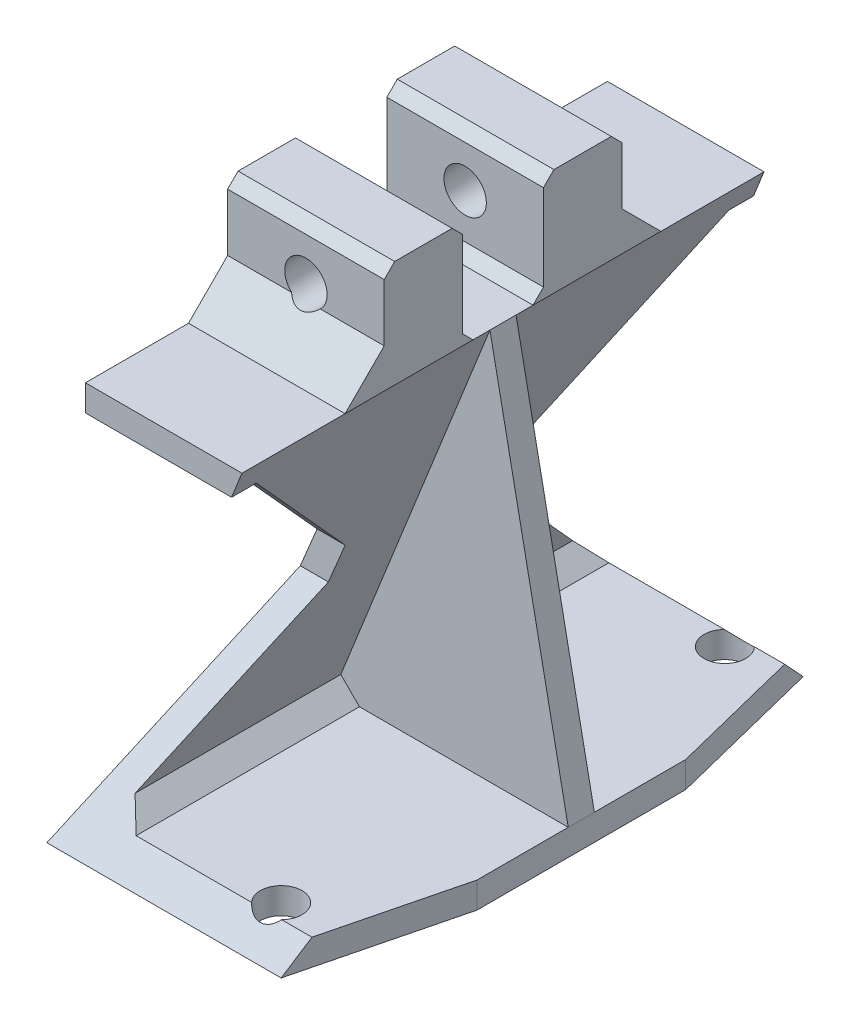
from build123d import *
from OCP.BRepFilletAPI import BRepFilletAPI_MakeChamfer

# Parameters (mm, degrees)
BOSS_EXTRUDE1_DEPTH     = 40
CUT_EXTRUDE1_DEPTH      = 30
CUT_EXTRUDE1_DEPTH_BACK = 30
CHAMFER1_SIZE           = 2
CHAMFER1_SIZE2          = 1.538618516
CHAMFER1_SIZE2_2        = 2.126587288
SKETCH3_R               = 1.6
CUT_EXTRUDE2_DEPTH      = 10
SKETCH4_W               = 6
SKETCH4_H               = 8.2
BOSS_EXTRUDE2_DEPTH     = 12
CHAMFER2_SIZE           = 3
CHAMFER3_SIZE           = 0.8
CUT_EXTRUDE3_DEPTH      = 47.848799344
CUT_EXTRUDE3_DEPTH_BACK = 47.848799344
SKETCH5_R               = 1.625
RIB1_REACH              = 43.809
SKETCH8_WALL_W          = 116.212296924
SKETCH8_WALL_H          = 2


with BuildPart() as part:
    # Sketch1 → Boss-Extrude1 (new body)
    with BuildSketch(Plane.XY):
        Polygon((0, 0), (12, 0), (0, -30), (18, -30), (18, -32), (-2.954065923, -32), (9.045934077, -2), (0, -2), align=None)
    extrude(amount=BOSS_EXTRUDE1_DEPTH)

    # Sketch2 → Cut-Extrude1 (cut, two sides: drawn at the far end of the back side and taken through both)
    with BuildSketch(Plane.ZY.offset(-CUT_EXTRUDE1_DEPTH_BACK)):
        Polygon((15.099668871, -16), (1.887458609, -2), (0, -2), (0, -32), align=None)
        Polygon((40, -2), (38.112541391, -2), (24.900331129, -16), (40, -32), align=None)
    extrude(amount=CUT_EXTRUDE1_DEPTH + CUT_EXTRUDE1_DEPTH_BACK, mode=Mode.SUBTRACT)

    # Chamfer1: one chamfer whose edges measure the first distance from different faces: ONE call of the kernel's chamfer builder (chamfer() names one face for all edges)
    chamfer1_edges_1 = [part.edges().sort_by_distance(p)[0] for p in [
        (0, -30, 20),
    ]]
    chamfer1_side_1 = [part.faces().sort_by_distance(p)[0] for p in [
        (9, -30, 20),
    ]]
    chamfer1_edges_2 = [part.edges().sort_by_distance(p)[0] for p in [
        (9.045934077, -2, 20),
    ]]
    chamfer1_side_2 = [part.faces().sort_by_distance(p)[0] for p in [
        (4.646047571, -2, 20),
    ]]
    chamfer1_edges_3 = [part.edges().sort_by_distance(p)[0] for p in [
        (4.522967039, -16, 24.900331129),
    ]]
    chamfer1_side_3 = [part.faces().sort_by_distance(p)[0] for p in [
        (7.322967039, -9, 31.50643626),
    ]]
    chamfer1_edges_4 = [part.edges().sort_by_distance(p)[0] for p in [
        (4.522967039, -16, 15.099668871),
    ]]
    chamfer1_side_4 = [part.faces().sort_by_distance(p)[0] for p in [
        (7.322967039, -9, 8.49356374),
    ]]
    chamfer1 = BRepFilletAPI_MakeChamfer(part.part.solid().wrapped)
    for e in chamfer1_edges_1:
        chamfer1.Add(CHAMFER1_SIZE, CHAMFER1_SIZE2, e.wrapped, chamfer1_side_1[0].wrapped)  # the first distance lies on this face
    for e in chamfer1_edges_2:
        chamfer1.Add(CHAMFER1_SIZE, CHAMFER1_SIZE2, e.wrapped, chamfer1_side_2[0].wrapped)  # the first distance lies on this face
    for e in chamfer1_edges_3:
        chamfer1.Add(CHAMFER1_SIZE, CHAMFER1_SIZE2_2, e.wrapped, chamfer1_side_3[0].wrapped)  # the first distance lies on this face
    for e in chamfer1_edges_4:
        chamfer1.Add(CHAMFER1_SIZE, CHAMFER1_SIZE2_2, e.wrapped, chamfer1_side_4[0].wrapped)  # the first distance lies on this face
    add(Compound.cast(chamfer1.Shape()), mode=Mode.REPLACE)

    # Sketch3 → Cut-Extrude2 (cut)
    with BuildSketch(Plane.XZ.offset(32)):
        Polygon((18, 40), (15, 40), (18, 28), align=None)
        Polygon((18, 0), (18, 12), (15, 0), align=None)
        with Locations(Location((12, 37, 0), (0, 0, 270))):
            Circle(SKETCH3_R)
        with Locations(Location((12, 3, 0), (0, 0, 270))):
            Circle(SKETCH3_R)
    extrude(amount=-CUT_EXTRUDE2_DEPTH, mode=Mode.SUBTRACT)

    # Sketch4 → Boss-Extrude2 (add)
    with BuildSketch(Plane.ZY):
        with Locations((13.9, 4.1)):
            Rectangle(SKETCH4_W, SKETCH4_H)
        with Locations((26.1, 4.1)):
            Rectangle(SKETCH4_W, SKETCH4_H)
    extrude(amount=-BOSS_EXTRUDE2_DEPTH)

    # Chamfer2
    chamfer2_edges = [part.edges().sort_by_distance(p)[0] for p in [
        (6, 0, 10.9),
        (6, 0, 29.1),
    ]]
    chamfer(chamfer2_edges, length=CHAMFER2_SIZE)

    # Chamfer3
    # the kernel refuses this chamfer: 0.8 mm, written as the material it adds along each edge
    with BuildSketch(Plane(origin=(0, 0, 16.9), x_dir=(0, 0.9996219169112966, -0.027495876610587354), z_dir=(1, 0, 0))) as chamfer3_piece_1_section:
        Polygon((CHAMFER3_SIZE * 0.999621916911, CHAMFER3_SIZE * 0.0274958766106), (-CHAMFER3_SIZE * 0.0274958766106, CHAMFER3_SIZE * 0.999621916911), (0, 0), align=None)
    chamfer3_piece_1 = extrude(amount=12, mode=Mode.PRIVATE)
    chamfer3_piece_1 = split(chamfer3_piece_1, bisect_by=Plane(origin=(11.263378783, -1.841553042, 17.163829715), z_dir=(-0.9284766908852594, 0.3713906763541038, 0)), keep=Keep.TOP, mode=Mode.PRIVATE)
    add(chamfer3_piece_1)
    with BuildSketch(Plane(origin=(0, 0, 23.1), x_dir=(0, 0.9996219169112966, 0.027495876610587354), z_dir=(1, 0, 0))) as chamfer3_piece_2_section:
        Polygon((CHAMFER3_SIZE * 0.999621916911, -CHAMFER3_SIZE * 0.0274958766106), (-CHAMFER3_SIZE * 0.0274958766106, -CHAMFER3_SIZE * 0.999621916911), (0, 0), align=None)
    chamfer3_piece_2 = extrude(amount=12, mode=Mode.PRIVATE)
    chamfer3_piece_2 = split(chamfer3_piece_2, bisect_by=Plane(origin=(11.263378783, -1.841553042, 22.836170285), z_dir=(-0.9284766908852594, 0.3713906763541038, 0)), keep=Keep.TOP, mode=Mode.PRIVATE)
    add(chamfer3_piece_2)
    # the kernel refuses this chamfer: 0.8 mm, written as the material it takes off along each edge
    with BuildSketch(Plane(origin=(-2.05734639, 8.2, 10.9), x_dir=(0, -0.9996219169112966, -0.02749587661058733), z_dir=(1, 0, 0)), Plane(origin=(-2.05734639, 8.2, 16.9), x_dir=(0, 0.027495876610587302, -0.9996219169112966), z_dir=(1, 0, 0)), Plane(origin=(-2.05734639, 8.2, 29.1), x_dir=(0, 0.027495876610587302, -0.9996219169112966), z_dir=(1, 0, 0)), Plane(origin=(-2.05734639, 8.2, 23.1), x_dir=(0, -0.9996219169112966, -0.02749587661058736), z_dir=(1, 0, 0))) as chamfer3_2_piece_1:
        Polygon((CHAMFER3_SIZE * 0.999621916911, -CHAMFER3_SIZE * 0.0274958766106), (-CHAMFER3_SIZE * 0.0274958766106, -CHAMFER3_SIZE * 0.999621916911), (0, 0), align=None)
    extrude(amount=16.114692781, mode=Mode.SUBTRACT)

    # Sketch5 → Cut-Extrude3 (cut, two sides: drawn at the far end of the back side and taken through both)
    with BuildSketch(Plane.XY.offset(29.1).offset(-CUT_EXTRUDE3_DEPTH_BACK)):
        with Locations(Location((6, 4.2, 0), (0, 0, 312.399473364))):
            Circle(SKETCH5_R)
    extrude(amount=CUT_EXTRUDE3_DEPTH + CUT_EXTRUDE3_DEPTH_BACK, mode=Mode.SUBTRACT)

    # Sketch8 wall → Rib1 (add, up to next)
    with BuildSketch(Plane(origin=(15, -15, 20), x_dir=(0.196116135138, -0.980580675691, 0), z_dir=(0.980580675691, 0.196116135138, 0)), mode=Mode.PRIVATE) as rib1_sk1:
        Rectangle(SKETCH8_WALL_W, SKETCH8_WALL_H)
    rib1_tool1 = extrude(rib1_sk1.sketch, amount=-RIB1_REACH, mode=Mode.PRIVATE) - part.part
    add(rib1_tool1.solids().sort_by_distance((15, -15, 20))[0])


solid = part.part
